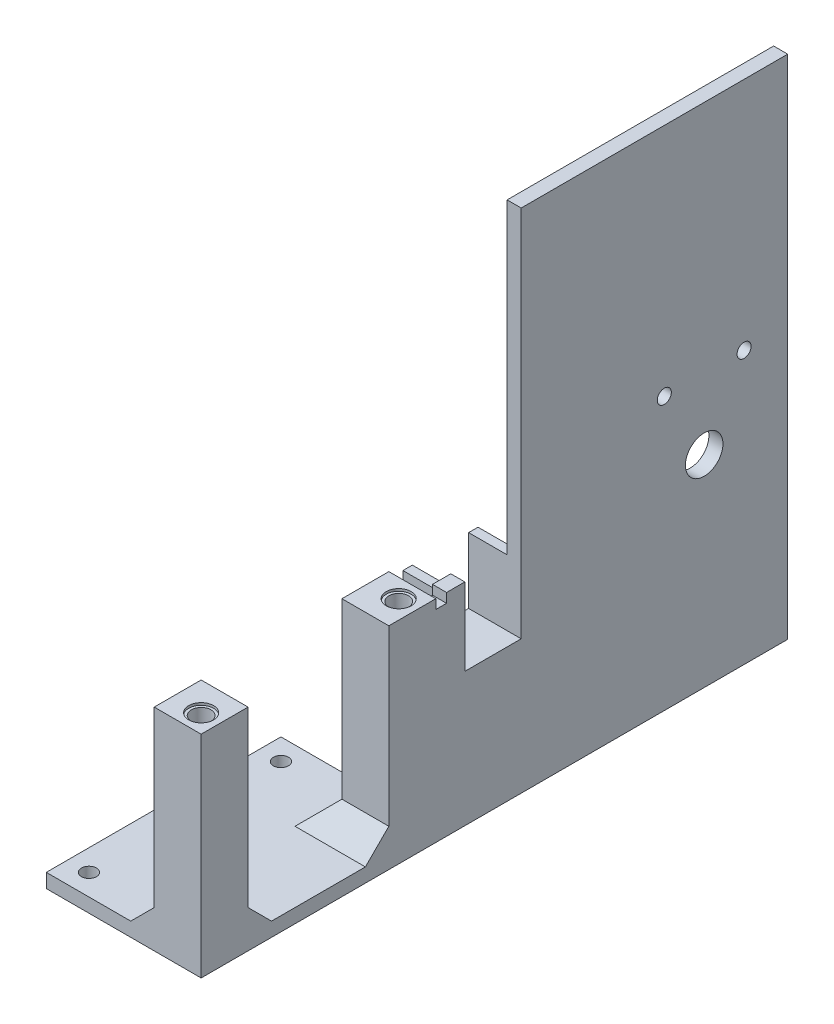
from build123d import *

# Parameters (mm, degrees)
SKETCH1_R           = 1.6
BOSS_EXTRUDE1_DEPTH = 3
SKETCH2_W           = 10
SKETCH2_H           = 10
BOSS_EXTRUDE2_DEPTH = 42
CHAMFER1_SIZE       = 5
SKETCH3_R           = 2.1
CUT_EXTRUDE1_DEPTH  = 52
SKETCH4_R           = 2.65
CUT_EXTRUDE2_DEPTH  = 0.5
SKETCH5_W           = 3
SKETCH5_H           = 43
BOSS_EXTRUDE3_DEPTH = 75
SKETCH6_W           = 3
SKETCH6_H           = 72.7
BOSS_EXTRUDE4_DEPTH = 2
SKETCH7_W           = 3
SKETCH7_H           = 68.8
BOSS_EXTRUDE5_DEPTH = 3
SKETCH8_R           = 1
BOSS_EXTRUDE7_DEPTH = 8.2
SKETCH9_W           = 12
SKETCH9_H           = 19.5
CUT_EXTRUDE3_DEPTH  = 8.5
SKETCH10_W          = 3
SKETCH10_H          = 56.8
BOSS_EXTRUDE8_DEPTH = 15
SKETCH11_R          = 4
CUT_EXTRUDE6_DEPTH  = 3
SKETCH12_R          = 1.5
CUT_EXTRUDE7_DEPTH  = 3
SKETCH13_W          = 3
SKETCH13_H          = 56.8
BOSS_EXTRUDE9_DEPTH = 45


with BuildPart() as part:
    # Sketch1 → Boss-Extrude1 (new body)
    with BuildSketch(Plane(origin=(0, 0, 0), x_dir=(1, 0, 0), z_dir=(0, 1, 0))):
        Polygon((-6.512396694, 9.685950413), (1.487603306, 9.685950413), (26.487603306, 9.685950413), (26.487603306, -40.314049587), (1.487603306, -40.314049587), (-6.512396694, -40.314049587), align=None)
        with Locations((-1.962396694, -35.764049587)):
            Circle(SKETCH1_R, mode=Mode.SUBTRACT)
        with Locations((-1.962396694, 5.135950413)):
            Circle(SKETCH1_R, mode=Mode.SUBTRACT)
    extrude(amount=BOSS_EXTRUDE1_DEPTH)

    # Sketch2 → Boss-Extrude2 (add)
    with BuildSketch(Plane(origin=(0, 3, 0), x_dir=(1, 0, 0), z_dir=(0, 1, 0))):
        with Locations((21.487603306, -35.314049587)):
            Rectangle(SKETCH2_W, SKETCH2_H)
        with Locations((21.487603306, 4.685950413)):
            Rectangle(SKETCH2_W, SKETCH2_H)
    extrude(amount=BOSS_EXTRUDE2_DEPTH)

    # Chamfer1
    chamfer1_edges = [part.edges().sort_by_distance(p)[0] for p in [
        (16.487603306, 3, -4.685950413),
        (21.487603306, 3, 0.314049587),
        (16.487603306, 3, 35.314049587),
        (21.487603306, 3, 30.314049587),
    ]]
    chamfer(chamfer1_edges, length=CHAMFER1_SIZE)

    # Sketch3 → Cut-Extrude1 (cut)
    with BuildSketch(Plane(origin=(0, 45, 0), x_dir=(1, 0, 0), z_dir=(0, 1, 0))):
        with Locations((22.537603306, -36.364049587)):
            Circle(SKETCH3_R)
        with Locations((22.537603306, 5.735950413)):
            Circle(SKETCH3_R)
    extrude(amount=-CUT_EXTRUDE1_DEPTH, mode=Mode.SUBTRACT)

    # Sketch4 → Cut-Extrude2 (cut)
    with BuildSketch(Plane(origin=(0, 45, 0), x_dir=(1, 0, 0), z_dir=(0, 1, 0))):
        with Locations((22.537603306, -36.364049587)):
            Circle(SKETCH4_R)
        with Locations((22.537603306, 5.735950413)):
            Circle(SKETCH4_R)
    cut_extrude2 = extrude(amount=-CUT_EXTRUDE2_DEPTH, mode=Mode.SUBTRACT)

    # Mirror1: Cut-Extrude2 across plane
    add(cut_extrude2.mirror(Plane(origin=(0, 22.5, 0), x_dir=(0, 0, 1), z_dir=(0, -1, 0))), mode=Mode.SUBTRACT)

    # Sketch5 → Boss-Extrude3 (add)
    with BuildSketch(Plane(origin=(0, 0, -9.685950413), x_dir=(-1, 0, 0), z_dir=(0, 0, -1))):
        with Locations((-24.987603306, 21.5)):
            Rectangle(SKETCH5_W, SKETCH5_H)
    extrude(amount=BOSS_EXTRUDE3_DEPTH)

    # Sketch6 → Boss-Extrude4 (add)
    with BuildSketch(Plane(origin=(0, 43, 0), x_dir=(1, 0, 0), z_dir=(0, 1, 0))):
        with Locations((24.987603306, 48.335950413)):
            Rectangle(SKETCH6_W, SKETCH6_H)
    extrude(amount=BOSS_EXTRUDE4_DEPTH)

    # Sketch7 → Boss-Extrude5 (add)
    with BuildSketch(Plane(origin=(0, 45, 0), x_dir=(1, 0, 0), z_dir=(0, 1, 0))):
        with Locations((24.987603306, 50.285950413)):
            Rectangle(SKETCH7_W, SKETCH7_H)
    extrude(amount=BOSS_EXTRUDE5_DEPTH)

    # Sketch8 → Boss-Extrude7 (add)
    with BuildSketch(Plane.ZY.offset(-23.487603306)):
        Polygon((-15.885950413, 28.5), (-27.885950413, 28.5), (-27.885950413, 42.5), (-29.885950413, 42.5), (-29.885950413, 22.5), (-13.885950413, 22.5), (-13.885950413, 42.5), (-15.885950413, 42.5), align=None)
        with Locations((-21.885950413, 24.5)):
            Circle(SKETCH8_R, mode=Mode.SUBTRACT)
    extrude(amount=BOSS_EXTRUDE7_DEPTH)

    # Sketch9 → Cut-Extrude3 (cut)
    with BuildSketch(Plane.ZY.offset(-23.487603306)):
        with Locations((-21.885950413, 38.25)):
            Rectangle(SKETCH9_W, SKETCH9_H)
    extrude(amount=-CUT_EXTRUDE3_DEPTH, mode=Mode.SUBTRACT)

    # Sketch10 → Boss-Extrude8 (add)
    with BuildSketch(Plane(origin=(0, 48, 0), x_dir=(1, 0, 0), z_dir=(0, 1, 0))):
        with Locations((24.987603306, 56.285950413)):
            Rectangle(SKETCH10_W, SKETCH10_H)
    extrude(amount=BOSS_EXTRUDE8_DEPTH)

    # Sketch11 → Cut-Extrude6 (cut)
    with BuildSketch(Plane(origin=(26.487603306, 0, 0), x_dir=(0, 0, -1), z_dir=(1, 0, 0))):
        with Locations((66.885950413, 43)):
            Circle(SKETCH11_R)
    extrude(amount=-CUT_EXTRUDE6_DEPTH, mode=Mode.SUBTRACT)

    # Sketch12 → Cut-Extrude7 (cut)
    with BuildSketch(Plane(origin=(26.487603306, 0, 0), x_dir=(0, 0, -1), z_dir=(1, 0, 0))):
        with Locations((58.385950413, 58)):
            Circle(SKETCH12_R)
        with Locations((75.385950413, 58)):
            Circle(SKETCH12_R)
    extrude(amount=-CUT_EXTRUDE7_DEPTH, mode=Mode.SUBTRACT)

    # Sketch13 → Boss-Extrude9 (add)
    with BuildSketch(Plane(origin=(0, 63, 0), x_dir=(1, 0, 0), z_dir=(0, 1, 0))):
        with Locations((24.987603306, 56.285950413)):
            Rectangle(SKETCH13_W, SKETCH13_H)
    extrude(amount=BOSS_EXTRUDE9_DEPTH)


solid = part.part
